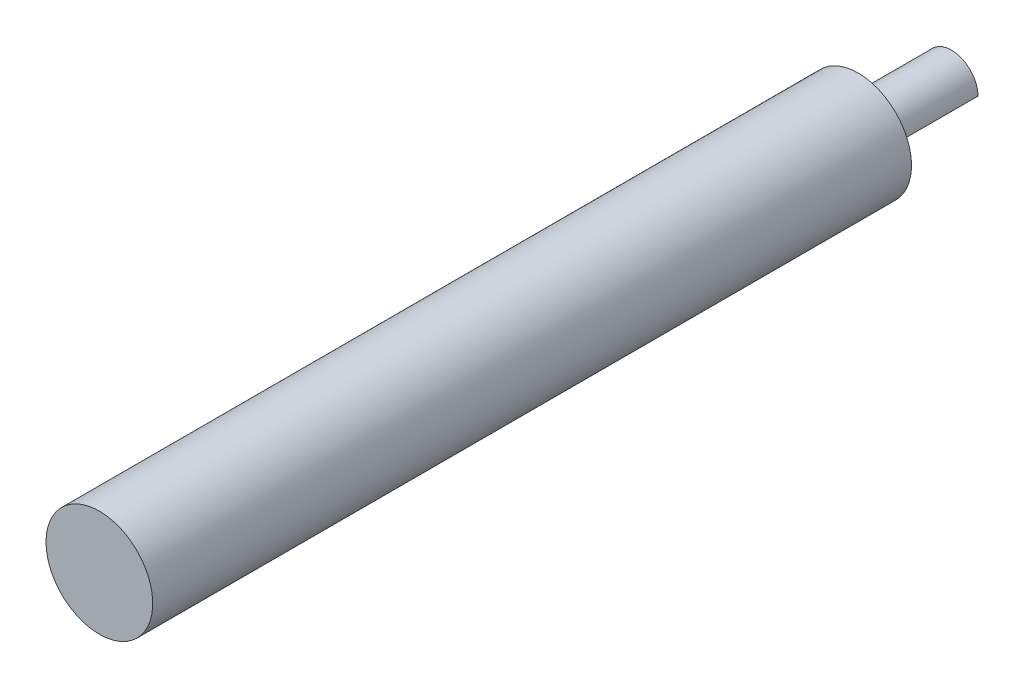
from build123d import *

# Parameters (mm, degrees)
SKETCH1_R               = 3.1623
BOSS_EXTRUDE1_DEPTH     = 11.0998
CUT_EXTRUDE1_DEPTH      = 12.96686436
CUT_EXTRUDE1_DEPTH_BACK = 12.96686436
SKETCH3_R               = 6.35
BOSS_EXTRUDE2_DEPTH     = 90.297


with BuildPart() as part:
    # Sketch1 → Boss-Extrude1 (new body)
    with BuildSketch(Plane.XY):
        Circle(SKETCH1_R)
    extrude(amount=BOSS_EXTRUDE1_DEPTH)

    # Sketch2 → Cut-Extrude1 (cut, two sides: drawn at the far end of the back side and taken through both)
    with BuildSketch(Plane(origin=(0, 0, 0), x_dir=(-1, 0, 0), z_dir=(0, 0, -1)).offset(-CUT_EXTRUDE1_DEPTH_BACK)):
        Polygon((17.073178183, -20.234228338), (0.001249598, -3.162299753), (-3.162299753, 0.001249598), (-20.234228338, 17.073178183), (-54.378085507, -17.070678986), (-17.070678986, -54.378085507), align=None)
    extrude(amount=CUT_EXTRUDE1_DEPTH + CUT_EXTRUDE1_DEPTH_BACK, mode=Mode.SUBTRACT)

    # Sketch3 → Boss-Extrude2 (add)
    with BuildSketch(Plane.XY.offset(11.0998)):
        Circle(SKETCH3_R)
    extrude(amount=BOSS_EXTRUDE2_DEPTH)


solid = part.part
